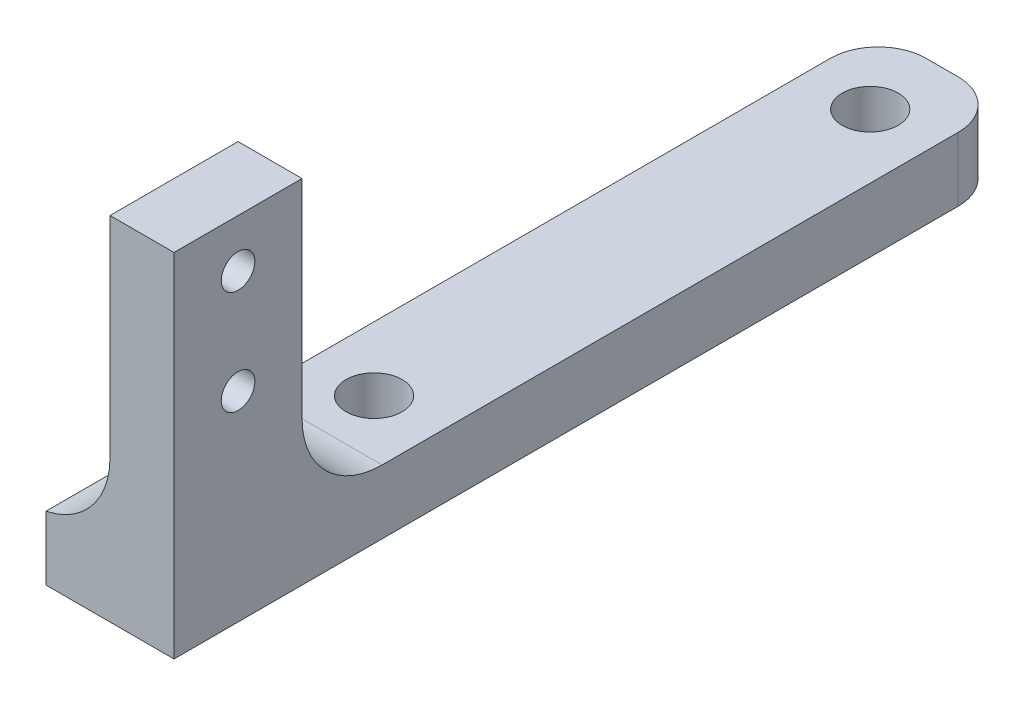
from build123d import *

# Parameters (mm, degrees)
SKETCH1_W           = 4
SKETCH1_H           = 8
SKETCH1_H_2         = 4.5
BOSS_EXTRUDE1_DEPTH = 4
SKETCH1_3_W         = 4
SKETCH1_3_H         = 8
BOSS_EXTRUDE2_DEPTH = 22
SKETCH3_R           = 1.05
CUT_EXTRUDE2_DEPTH  = 15
FILLET1_START       = -0.04496
FILLET1_DEPTH       = 4.04496
FILLET1_START_2     = -4.000000861
FILLET1_2_DEPTH     = 3.955040861
FILLET1_START_3     = 2
FILLET1_3_DEPTH     = 6.5
FILLET1_START_4     = 8.5
FILLET1_4_DEPTH     = 8
FILLET2_R           = 3


with BuildPart() as part:
    # Sketch1 → Boss-Extrude1 (new body)
    # profile 1 of 3: a face of its own
    with BuildSketch(Plane(origin=(0, 0, 0), x_dir=(1, 0, 0), z_dir=(0, 1, 0))):
        with Locations((2, -12.5)):
            Rectangle(SKETCH1_W, SKETCH1_H)
    # profile 2 of 3: a face of its own
    with BuildSketch(Plane(origin=(0, 0, 0), x_dir=(1, 0, 0), z_dir=(0, 1, 0))):
        Polygon((-4, -16.5), (0, -16.5), (0, -8.5), (0, -4), (4, -4), (4, 35.5), (-4, 35.5), align=None)
        with BuildLine():
            ThreePointArc((1.75, 0), (-1.237436867, -1.237436867), (0, 1.75))
            ThreePointArc((0, 1.75), (1.237436867, 1.237436867), (1.75, 0))
        make_face(mode=Mode.SUBTRACT)
        with BuildLine():
            ThreePointArc((1.75, 31), (1.237436867, 29.762563133), (0, 29.25))
            ThreePointArc((0, 29.25), (-1.237436867, 32.237436867), (1.75, 31))
        make_face(mode=Mode.SUBTRACT)
    # profile 3 of 3: a face of its own
    with BuildSketch(Plane(origin=(0, 0, 0), x_dir=(1, 0, 0), z_dir=(0, 1, 0))):
        with Locations((2, -6.25)):
            Rectangle(SKETCH1_W, SKETCH1_H_2)
    extrude(amount=BOSS_EXTRUDE1_DEPTH)

    # Sketch1<3> → Boss-Extrude2 (add)
    with BuildSketch(Plane(origin=(0, 0, 0), x_dir=(1, 0, 0), z_dir=(0, 1, 0))):
        with Locations((2, -12.5)):
            Rectangle(SKETCH1_3_W, SKETCH1_3_H)
    extrude(amount=BOSS_EXTRUDE2_DEPTH)

    # Sketch3 → Cut-Extrude2 (cut)
    with BuildSketch(Plane.ZY):
        with Locations((12.5, 19)):
            Circle(SKETCH3_R)
        with Locations((12.5, 12.5)):
            Circle(SKETCH3_R)
    extrude(amount=-CUT_EXTRUDE2_DEPTH, mode=Mode.SUBTRACT)

    # Fillet1: read off the stored shape, not the designer's step
    # Fillet1 outline → Fillet1 (add)
    with BuildSketch(Plane.YZ.offset(FILLET1_START)):
        with BuildLine():
            ThreePointArc((4, 3.5), (5.464466094, 7.035533906), (9, 8.5))
            Line((9, 8.5), (4, 8.5))
            Line((4, 8.5), (4, 3.5))
        make_face()
    extrude(amount=FILLET1_DEPTH)

    # Fillet1 2 outline → Fillet1 2 (add)
    with BuildSketch(Plane.YZ.offset(FILLET1_START_2)):
        with BuildLine():
            ThreePointArc((4, 3.5), (5.464466094, 7.035533906), (9, 8.5))
            Line((9, 8.5), (4, 8.5))
            Line((4, 8.5), (4, 3.5))
        make_face()
    extrude(amount=FILLET1_2_DEPTH)

    # Fillet1 3 outline → Fillet1 3 (cut)
    with BuildSketch(Plane.XY.offset(FILLET1_START_3)):
        with BuildLine():
            Line((-4.000000861, 10), (-4.000045415, 3.99999073))
            ThreePointArc((-4.000045415, 3.99999073), (-1.127031311, 5.736683874), (0, 8.898979486))
            Line((0, 8.898979486), (0, 10))
            Line((0, 10), (-4.000000861, 10))
        make_face()
    extrude(amount=FILLET1_3_DEPTH, mode=Mode.SUBTRACT)

    # Fillet1 4 outline → Fillet1 4 (add)
    with BuildSketch(Plane.XY.offset(FILLET1_START_4)):
        with BuildLine():
            ThreePointArc((0, 8.898979486), (-1.127031311, 5.736683874), (-4.000045415, 3.99999073))
            Line((-4.000045415, 3.99999073), (0, 4))
            Line((0, 4), (0, 8.898979486))
        make_face()
    extrude(amount=FILLET1_4_DEPTH)

    # Fillet2
    fillet2_edges = [part.edges().sort_by_distance(p)[0] for p in [
        (-4, 2, -35.5),
        (4, 2, -35.5),
    ]]
    fillet(fillet2_edges, radius=FILLET2_R)


solid = part.part
